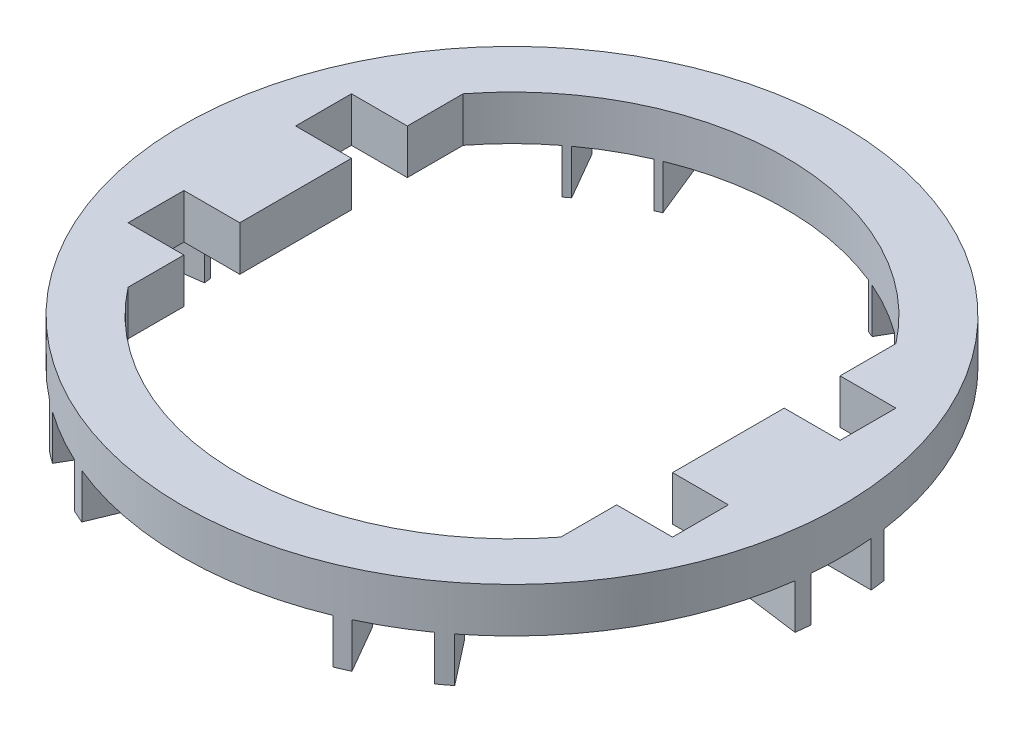
from build123d import *

# Parameters (mm, degrees)
BOSS_EXTRUDE1_DEPTH   = 8
BOSS_EXTRUDE1_2_DEPTH = 8
BOSS_EXTRUDE1_3_DEPTH = 8
BOSS_EXTRUDE1_4_DEPTH = 8
BOSS_EXTRUDE1_5_DEPTH = 8
BOSS_EXTRUDE1_6_DEPTH = 8
BOSS_EXTRUDE2_DEPTH   = 8
BOSS_EXTRUDE3_DEPTH   = 8
SKETCH7_W             = 10
SKETCH7_H             = 10
CUT_EXTRUDE1_DEPTH    = 70
BOSS_EXTRUDE4_START   = -8
BOSS_EXTRUDE4_DEPTH   = 8
BOSS_EXTRUDE5_DEPTH   = 8


with BuildPart() as part:
    # Sketch1 → Boss-Extrude1 (new body)
    with BuildSketch(Plane(origin=(0, 0, 0), x_dir=(1, 0, 0), z_dir=(0, 1, 0))):
        with BuildLine():
            Line((48.53037343, 6.767780637), (58.434531273, 8.148960359))
            ThreePointArc((58.434531273, 8.148960359), (58.599760274, 6.860619197), (58.736587944, 5.568952925))
            Line((58.736587944, 5.568952925), (48.68250983, 5.568952925))
            ThreePointArc((48.68250983, 5.568952925), (48.61013747, 6.168835799), (48.53037343, 6.767780637))
        make_face()
    extrude(amount=BOSS_EXTRUDE1_DEPTH)



with BuildPart() as body_2:
    # Sketch1 → Boss-Extrude1 2 (new body)
    with BuildSketch(Plane(origin=(0, 0, 0), x_dir=(1, 0, 0), z_dir=(0, 1, 0))):
        with BuildLine():
            Line((18.404116756, 45.412426564), (22.160058951, 54.68026872))
            ThreePointArc((22.160058951, 54.68026872), (23.358409627, 54.179190652), (24.545439267, 53.651853754))
            Line((24.545439267, 53.651853754), (19.518400209, 44.944766695))
            ThreePointArc((19.518400209, 44.944766695), (18.962700221, 45.18203183), (18.404116756, 45.412426564))
        make_face()
    extrude(amount=BOSS_EXTRUDE1_2_DEPTH)


with BuildPart() as body_3:
    # Sketch1 → Boss-Extrude1 3 (new body)
    with BuildSketch(Plane(origin=(0, 0, 0), x_dir=(1, 0, 0), z_dir=(0, 1, 0))):
        with BuildLine():
            Line((29.904437191, 38.816551061), (36.007383557, 46.738296175))
            ThreePointArc((36.007383557, 46.738296175), (34.969196448, 47.520051555), (33.914042358, 48.278750304))
            Line((33.914042358, 48.278750304), (28.890208092, 39.577214106))
            ThreePointArc((28.890208092, 39.577214106), (29.399782832, 39.200162875), (29.904437191, 38.816551061))
        make_face()
    extrude(amount=BOSS_EXTRUDE1_3_DEPTH)


with BuildPart() as body_4:
    # Sketch1 → Boss-Extrude1 4 (new body)
    with BuildSketch(Plane(origin=(0, 0, 0), x_dir=(1, 0, 0), z_dir=(0, 1, 0))):
        with BuildLine():
            Line((48.568337902, -6.489726763), (58.480243596, -7.814160796))
            ThreePointArc((58.480243596, -7.814160796), (58.63817006, -6.524186697), (58.767645405, -5.231047075))
            Line((58.767645405, -5.231047075), (48.719976873, -5.231047075))
            ThreePointArc((48.719976873, -5.231047075), (48.648228298, -5.860877361), (48.568337902, -6.489726763))
        make_face()
    extrude(amount=BOSS_EXTRUDE1_4_DEPTH)


with BuildPart() as body_5:
    # Sketch1 → Boss-Extrude1 5 (new body)
    with BuildSketch(Plane(origin=(0, 0, 0), x_dir=(1, 0, 0), z_dir=(0, 1, 0))):
        with BuildLine():
            Line((30.126256674, -38.644645927), (36.274472321, -46.531308361))
            ThreePointArc((36.274472321, -46.531308361), (35.241350648, -47.318571455), (34.191148678, -48.082900829))
            Line((34.191148678, -48.082900829), (29.16410962, -39.37581377))
            ThreePointArc((29.16410962, -39.37581377), (29.647437249, -39.013196031), (30.126256674, -38.644645927))
        make_face()
    extrude(amount=BOSS_EXTRUDE1_5_DEPTH)


with BuildPart() as body_6:
    # Sketch1 → Boss-Extrude1 6 (new body)
    with BuildSketch(Plane(origin=(0, 0, 0), x_dir=(1, 0, 0), z_dir=(0, 1, 0))):
        with BuildLine():
            Line((18.66390071, -45.306277824), (22.472860039, -54.552456972))
            ThreePointArc((22.472860039, -54.552456972), (23.668973612, -54.044238251), (24.853603047, -53.509797379))
            Line((24.853603047, -53.509797379), (19.829768781, -44.808261181))
            ThreePointArc((19.829768781, -44.808261181), (19.248445466, -45.061040236), (18.66390071, -45.306277824))
        make_face()
    extrude(amount=BOSS_EXTRUDE1_6_DEPTH)


with BuildPart() as part_1:
    add(part.part)

    add(body_2.part)  # Boss-Extrude2 merges body 2

    add(body_3.part)  # Boss-Extrude2 merges body 3

    add(body_4.part)  # Boss-Extrude2 merges body 4

    add(body_5.part)  # Boss-Extrude2 merges body 5

    add(body_6.part)  # Boss-Extrude2 merges body 6
    # Sketch2 → Boss-Extrude2 (add)
    with BuildSketch(Plane(origin=(0, 8, 0), x_dir=(1, 0, 0), z_dir=(0, 1, 0))):
        with BuildLine():
            Line((22.160058951, 54.68026872), (18.404116756, 45.412426564))
            ThreePointArc((18.404116756, 45.412426564), (48.999799093, 0.140316836), (18.66390071, -45.306277824))
            Line((18.66390071, -45.306277824), (22.472860039, -54.552456972))
            ThreePointArc((22.472860039, -54.552456972), (58.999758092, 0.168952925), (22.160058951, 54.68026872))
        make_face()
    extrude(amount=BOSS_EXTRUDE2_DEPTH)

    # Sketch3 → Boss-Extrude3 (add)
    with BuildSketch(Plane.XZ.offset(-8)):
        with BuildLine():
            Line((38.742741256, -30), (38.742741256, 30))
            ThreePointArc((38.742741256, 30), (49, 0), (38.742741256, -30))
        make_face()
    extrude(amount=-BOSS_EXTRUDE3_DEPTH)

    # Sketch7 → Cut-Extrude1 (cut)
    with BuildSketch(Plane(origin=(0, 16, 0), x_dir=(1, 0, 0), z_dir=(0, 1, 0))):
        with Locations((43.742741256, 15)):
            Rectangle(SKETCH7_W, SKETCH7_H)
        with Locations((43.742741256, -15)):
            Rectangle(SKETCH7_W, SKETCH7_H)
    extrude(amount=-CUT_EXTRUDE1_DEPTH, mode=Mode.SUBTRACT)

    # Sketch8 → Boss-Extrude4 (add)
    with BuildSketch(Plane(origin=(0, 16, 0), x_dir=(1, 0, 0), z_dir=(0, 1, 0)).offset(BOSS_EXTRUDE4_START)):
        with BuildLine():
            Line((22.472860039, -54.552456972), (18.66390071, -45.306277824))
            ThreePointArc((18.66390071, -45.306277824), (-12.623806661, -47.345955534), (-38.742741256, -30))
            Line((-38.742741256, -30), (-38.742741256, -20))
            Line((-38.742741256, -20), (-48.742741256, -20))
            Line((-48.742741256, -20), (-48.742741256, -10))
            Line((-48.742741256, -10), (-38.742741256, -10))
            Line((-38.742741256, -10), (-38.742741256, 10))
            Line((-38.742741256, 10), (-48.742741256, 10))
            Line((-48.742741256, 10), (-48.742741256, 20))
            Line((-48.742741256, 20), (-38.742741256, 20))
            Line((-38.742741256, 20), (-38.742741256, 30))
            ThreePointArc((-38.742741256, 30), (-12.759335201, 47.309611764), (18.404116756, 45.412426564))
            Line((18.404116756, 45.412426564), (22.160058951, 54.68026872))
            ThreePointArc((22.160058951, 54.68026872), (-58.999758092, -0.168952925), (22.472860039, -54.552456972))
        make_face()
    extrude(amount=BOSS_EXTRUDE4_DEPTH)

    # Sketch9 → Boss-Extrude5 (add)
    with BuildSketch(Plane.XZ):
        with BuildLine():
            Line((-18.404116756, -45.412426564), (-22.160058951, -54.68026872))
            ThreePointArc((-22.160058951, -54.68026872), (-23.358409627, -54.179190652), (-24.545439267, -53.651853754))
            Line((-24.545439267, -53.651853754), (-19.518400209, -44.944766695))
            ThreePointArc((-19.518400209, -44.944766695), (-18.962700221, -45.18203183), (-18.404116756, -45.412426564))
        make_face()
        with BuildLine():
            Line((-29.904437191, -38.816551061), (-36.007383557, -46.738296175))
            ThreePointArc((-36.007383557, -46.738296175), (-34.969196448, -47.520051555), (-33.914042358, -48.278750304))
            Line((-33.914042358, -48.278750304), (-28.890208092, -39.577214106))
            ThreePointArc((-28.890208092, -39.577214106), (-29.399782832, -39.200162875), (-29.904437191, -38.816551061))
        make_face()
        with BuildLine():
            Line((-48.53037343, -6.767780637), (-58.434531273, -8.148960359))
            ThreePointArc((-58.434531273, -8.148960359), (-58.599760274, -6.860619197), (-58.736587944, -5.568952925))
            Line((-58.736587944, -5.568952925), (-48.68250983, -5.568952925))
            ThreePointArc((-48.68250983, -5.568952925), (-48.61013747, -6.168835799), (-48.53037343, -6.767780637))
        make_face()
        with BuildLine():
            Line((-48.568337902, 6.489726763), (-58.480243596, 7.814160796))
            ThreePointArc((-58.480243596, 7.814160796), (-58.63817006, 6.524186697), (-58.767645405, 5.231047075))
            Line((-58.767645405, 5.231047075), (-48.719976873, 5.231047075))
            ThreePointArc((-48.719976873, 5.231047075), (-48.648228298, 5.860877361), (-48.568337902, 6.489726763))
        make_face()
        with BuildLine():
            Line((-30.126256674, 38.644645927), (-36.274472321, 46.531308361))
            ThreePointArc((-36.274472321, 46.531308361), (-35.241350648, 47.318571455), (-34.191148678, 48.082900829))
            Line((-34.191148678, 48.082900829), (-29.16410962, 39.37581377))
            ThreePointArc((-29.16410962, 39.37581377), (-29.647437249, 39.013196031), (-30.126256674, 38.644645927))
        make_face()
        with BuildLine():
            Line((34.191148678, 48.082900829), (29.16410962, 39.37581377))
            ThreePointArc((29.16410962, 39.37581377), (29.647437249, 39.013196031), (30.126256674, 38.644645927))
            Line((30.126256674, 38.644645927), (36.274472321, 46.531308361))
            ThreePointArc((36.274472321, 46.531308361), (35.241350648, 47.318571455), (34.191148678, 48.082900829))
        make_face()
        with BuildLine():
            Line((33.914042358, -48.278750304), (28.890208092, -39.577214106))
            ThreePointArc((28.890208092, -39.577214106), (29.399782832, -39.200162875), (29.904437191, -38.816551061))
            Line((29.904437191, -38.816551061), (36.007383557, -46.738296175))
            ThreePointArc((36.007383557, -46.738296175), (34.969196448, -47.520051555), (33.914042358, -48.278750304))
        make_face()
        with BuildLine():
            Line((24.853603047, 53.509797379), (19.829768781, 44.808261181))
            ThreePointArc((19.829768781, 44.808261181), (19.248445466, 45.061040236), (18.66390071, 45.306277824))
            Line((18.66390071, 45.306277824), (22.472860039, 54.552456972))
            ThreePointArc((22.472860039, 54.552456972), (23.668973612, 54.044238251), (24.853603047, 53.509797379))
        make_face()
        with BuildLine():
            Line((58.736587944, -5.568952925), (48.68250983, -5.568952925))
            ThreePointArc((48.68250983, -5.568952925), (48.61013747, -6.168835799), (48.53037343, -6.767780637))
            Line((48.53037343, -6.767780637), (58.434531273, -8.148960359))
            ThreePointArc((58.434531273, -8.148960359), (58.599760274, -6.860619197), (58.736587944, -5.568952925))
        make_face()
        with BuildLine():
            Line((58.767645405, 5.231047075), (48.719976873, 5.231047075))
            ThreePointArc((48.719976873, 5.231047075), (48.648228298, 5.860877361), (48.568337902, 6.489726763))
            Line((48.568337902, 6.489726763), (58.480243596, 7.814160796))
            ThreePointArc((58.480243596, 7.814160796), (58.63817006, 6.524186697), (58.767645405, 5.231047075))
        make_face()
        with BuildLine():
            Line((24.545439267, -53.651853754), (19.518400209, -44.944766695))
            ThreePointArc((19.518400209, -44.944766695), (18.962700221, -45.18203183), (18.404116756, -45.412426564))
            Line((18.404116756, -45.412426564), (22.160058951, -54.68026872))
            ThreePointArc((22.160058951, -54.68026872), (23.358409627, -54.179190652), (24.545439267, -53.651853754))
        make_face()
        with BuildLine():
            Line((-18.66390071, 45.306277824), (-22.472860039, 54.552456972))
            ThreePointArc((-22.472860039, 54.552456972), (-23.668973612, 54.044238251), (-24.853603047, 53.509797379))
            Line((-24.853603047, 53.509797379), (-19.829768781, 44.808261181))
            ThreePointArc((-19.829768781, 44.808261181), (-19.248445466, 45.061040236), (-18.66390071, 45.306277824))
        make_face()
    extrude(amount=-BOSS_EXTRUDE5_DEPTH)


solid = part_1.part
